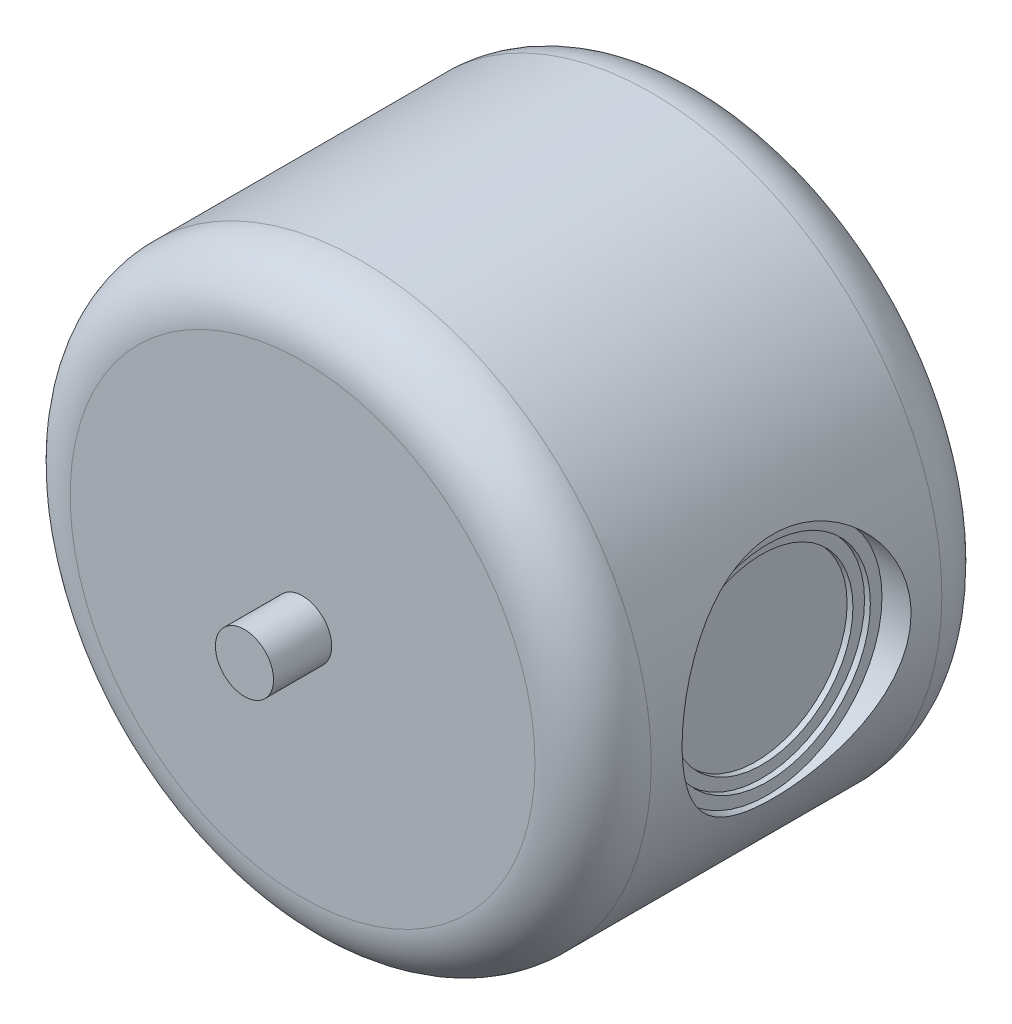
from build123d import *

# Parameters (mm, degrees)
SKETCH1_R           = 50
BOSS_EXTRUDE1_DEPTH = 35
SKETCH2_R           = 5
BOSS_EXTRUDE2_DEPTH = 45
FILLET1_R           = 10
SKETCH3_R           = 19.698674941
CUT_EXTRUDE1_DEPTH  = 5
SKETCH4_R           = 17.698674941
CUT_EXTRUDE2_DEPTH  = 1
SKETCH5_R           = 15.698674941
CUT_EXTRUDE3_DEPTH  = 1


with BuildPart() as part:
    # Sketch1 → Boss-Extrude1 (new, symmetric)
    with BuildSketch(Plane.XY):
        Circle(SKETCH1_R)
    extrude(amount=BOSS_EXTRUDE1_DEPTH, both=True)

    # Sketch2 → Boss-Extrude2 (add, symmetric)
    with BuildSketch(Plane.XY):
        Circle(SKETCH2_R)
    extrude(amount=BOSS_EXTRUDE2_DEPTH, both=True)

    # Fillet1
    fillet1_edges = [part.edges().sort_by_distance(p)[0] for p in [
        (-50, 0, -35),
        (-50, 0, 35),
    ]]
    fillet(fillet1_edges, radius=FILLET1_R)

    # Sketch3 → Cut-Extrude1 (cut)
    with BuildSketch(Plane(origin=(50, 0, 0), x_dir=(0, 0, -1), z_dir=(1, 0, 0))):
        Circle(SKETCH3_R)
    extrude(amount=-CUT_EXTRUDE1_DEPTH, mode=Mode.SUBTRACT)

    # Sketch4 → Cut-Extrude2 (cut)
    with BuildSketch(Plane(origin=(45, 0, 0), x_dir=(0, 0, -1), z_dir=(1, 0, 0))):
        Circle(SKETCH4_R)
    extrude(amount=-CUT_EXTRUDE2_DEPTH, mode=Mode.SUBTRACT)

    # Sketch5 → Cut-Extrude3 (cut)
    with BuildSketch(Plane(origin=(44, 0, 0), x_dir=(0, 0, -1), z_dir=(1, 0, 0))):
        Circle(SKETCH5_R)
    extrude(amount=-CUT_EXTRUDE3_DEPTH, mode=Mode.SUBTRACT)


solid = part.part
